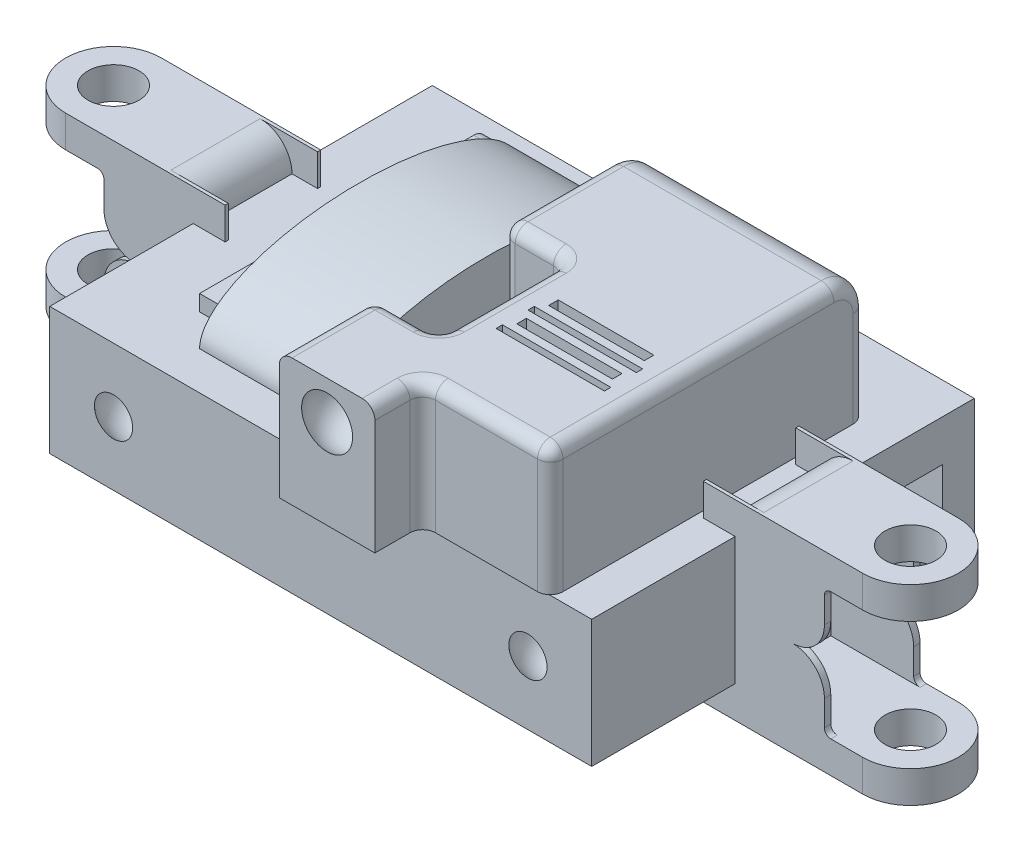
from build123d import *

# Parameters (mm, degrees)
SKETCH1_W                = 85
SKETCH1_H                = 60
BOSS_EXTRUDE1_DEPTH      = 20
BOSS_EXTRUDE4_DEPTH      = 5
SKETCH4_W                = 4
SKETCH4_H                = 14
CUT_EXTRUDE2_DEPTH       = 5
FILLET1_R                = 5
SKETCH5_W                = 14
SKETCH5_H                = 10
BOSS_EXTRUDE6_DEPTH      = 7.5
SKETCH7_W                = 12
SKETCH7_H                = 13
CUT_EXTRUDE5_DEPTH       = 10
SKETCH8_W                = 13
SKETCH8_H                = 10
CUT_EXTRUDE6_DEPTH       = 10
FILLET4_R                = 5
FILLET5_R                = 1
SKETCH9_R                = 4
CUT_EXTRUDE7_DEPTH       = 10
BOSS_EXTRUDE7_DEPTH      = 20
FILLET6_R                = 5
FILLET7_START            = 20
FILLET7_DEPTH            = 21
FILLET7_2_DEPTH          = 20
FILLET8_R                = 2
CIRPATTERN1_COUNT        = 2
FILLET1_OF_CIRPATTERN1_R = 5
FILLET4_OF_CIRPATTERN1_R = 5
FILLET5_OF_CIRPATTERN1_R = 1
CIRPATTERN5_START        = -7.5
CIRPATTERN5_DEPTH        = 1
CIRPATTERN5_START_2      = 6.5
CIRPATTERN5_2_DEPTH      = 1
CIRPATTERN5_START_3      = -5
CIRPATTERN5_3_OUTLINE_R  = 4
CIRPATTERN5_3_DEPTH      = 5
CIRPATTERN5_4_OUTLINE_W  = 1
CIRPATTERN5_4_OUTLINE_H  = 15
CIRPATTERN5_4_DEPTH      = 10
CIRPATTERN5_START_4      = -7
CIRPATTERN5_5_DEPTH      = 14
CIRPATTERN5_6_DEPTH      = 14
MIRROR1_START            = -7.5
MIRROR1_DEPTH            = 1
MIRROR1_START_2          = 6.5
MIRROR1_2_DEPTH          = 1
MIRROR1_START_3          = -5
MIRROR1_3_OUTLINE_R      = 4
MIRROR1_3_DEPTH          = 5
MIRROR1_4_OUTLINE_W      = 1
MIRROR1_4_OUTLINE_H      = 15
MIRROR1_4_DEPTH          = 10
MIRROR1_START_4          = -7
MIRROR1_5_DEPTH          = 14
MIRROR1_6_DEPTH          = 14
SKETCH16_W               = 17
SKETCH16_H               = 1
CUT_EXTRUDE9_DEPTH       = 5
BOSS_EXTRUDE8_DEPTH      = 20
BOSS_EXTRUDE9_DEPTH      = 5
SKETCH25_W               = 9
SKETCH25_H               = 7
CUT_EXTRUDE10_DEPTH      = 126.921602595
SKETCH11_W               = 15
SKETCH11_H               = 1.5
CUT_EXTRUDE8_DEPTH       = 20


with BuildPart() as part:
    # Sketch1 → Boss-Extrude1 (new body)
    with BuildSketch(Plane(origin=(0, 0, 0), x_dir=(1, 0, 0), z_dir=(0, 1, 0))):
        Rectangle(SKETCH1_W, SKETCH1_H)
    extrude(amount=BOSS_EXTRUDE1_DEPTH)

    # Sketch2 → Boss-Extrude4 (add)
    with BuildSketch(Plane(origin=(0, 20, 0), x_dir=(1, 0, 0), z_dir=(0, 1, 0))):
        with BuildLine():
            Line((-37.5, 7.5), (-62.5, 7.5))
            ThreePointArc((-62.5, 7.5), (-70, 0), (-62.5, -7.5))
            Line((-62.5, -7.5), (-37.5, -7.5))
            Line((-37.5, -7.5), (-37.5, 7.5))
        make_face()
    boss_extrude4 = extrude(amount=BOSS_EXTRUDE4_DEPTH)

    # Sketch4 → Cut-Extrude2 (cut)
    with BuildSketch(Plane(origin=(0, 25, 0), x_dir=(1, 0, 0), z_dir=(0, 1, 0))):
        with Locations((-39.5, 0)):
            Rectangle(SKETCH4_W, SKETCH4_H)
    cut_extrude2 = extrude(amount=-CUT_EXTRUDE2_DEPTH, mode=Mode.SUBTRACT)

    # Fillet1
    fillet1_edges = [part.edges().sort_by_distance(p)[0] for p in [
        (-41.5, 25, 0),
    ]]
    fillet(fillet1_edges, radius=FILLET1_R - 0.0001)  # a hair under: the kernel refuses the full size

    # Sketch5 → Boss-Extrude6 (add, symmetric)
    with BuildSketch(Plane.XY):
        with Locations((-49.5, 15)):
            Rectangle(SKETCH5_W, SKETCH5_H)
    boss_extrude6 = extrude(amount=BOSS_EXTRUDE6_DEPTH, both=True)

    # Sketch7 → Cut-Extrude5 (cut)
    with BuildSketch(Plane.XZ.offset(-10)):
        with Locations((-49.5, 0)):
            Rectangle(SKETCH7_W, SKETCH7_H)
    cut_extrude5 = extrude(amount=-CUT_EXTRUDE5_DEPTH, mode=Mode.SUBTRACT)

    # Sketch8 → Cut-Extrude6 (cut)
    with BuildSketch(Plane(origin=(-55.5, 0, 0), x_dir=(0, 0, -1), z_dir=(1, 0, 0))):
        with Locations((0, 15)):
            Rectangle(SKETCH8_W, SKETCH8_H)
    cut_extrude6 = extrude(amount=-CUT_EXTRUDE6_DEPTH, mode=Mode.SUBTRACT)

    # Fillet4
    fillet4_edges = [part.edges().sort_by_distance(p)[0] for p in [
        (-56.5, 10, -7),
        (-56.5, 10, 7),
    ]]
    fillet(fillet4_edges, radius=FILLET4_R)

    # Fillet5
    fillet5_edges = [part.edges().sort_by_distance(p)[0] for p in [
        (-56.5, 20, -7),
        (-56.5, 20, 7),
    ]]
    fillet(fillet5_edges, radius=FILLET5_R)

    # Sketch9 → Cut-Extrude7 (cut)
    with BuildSketch(Plane(origin=(0, 25, 0), x_dir=(1, 0, 0), z_dir=(0, 1, 0))):
        with Locations(Location((-62.5, 0, 0), (0, 0, 270))):
            Circle(SKETCH9_R)
    cut_extrude7 = extrude(amount=-CUT_EXTRUDE7_DEPTH, mode=Mode.SUBTRACT)

    # Sketch10 → Boss-Extrude7 (add)
    with BuildSketch(Plane(origin=(0, 20, 0), x_dir=(1, 0, 0), z_dir=(0, 1, 0))):
        Polygon((1.5, -3), (11.5, -3), (11.5, -23), (1.5, -23), (1.5, -38), (16.5, -38), (16.5, -30.5), (36.5, -30.5), (36.5, 0.746164075), (36.5, 19), (1.5, 19), align=None)
    extrude(amount=BOSS_EXTRUDE7_DEPTH)

    # Fillet6
    fillet6_edges = [part.edges().sort_by_distance(p)[0] for p in [
        (19, 40, -19),
    ]]
    fillet(fillet6_edges, radius=FILLET6_R)

    # Fillet7: read off the stored shape, not the designer's step
    # Fillet7 outline → Fillet7 (cut)
    with BuildSketch(Plane(origin=(0, 0, 0), x_dir=(1, 0, 0), z_dir=(0, 1, 0)).offset(FILLET7_START)):
        with BuildLine():
            Line((36.5, -30.5), (36.5, -28.5))
            ThreePointArc((36.5, -28.5), (35.914213562, -29.914213562), (34.5, -30.5))
            Line((34.5, -30.5), (36.5, -30.5))
        make_face()
        with BuildLine():
            Line((1.5, -23), (1.5, -25))
            ThreePointArc((1.5, -25), (2.085786438, -23.585786438), (3.5, -23))
            Line((3.5, -23), (1.5, -23))
        make_face()
        with BuildLine():
            Line((1.5, -3), (3.5, -3))
            ThreePointArc((3.5, -3), (2.085786438, -2.414213562), (1.5, -1))
            Line((1.5, -1), (1.5, -3))
        make_face()
    extrude(amount=FILLET7_DEPTH, mode=Mode.SUBTRACT)

    # Fillet7 2 outline → Fillet7 2 (add)
    with BuildSketch(Plane(origin=(0, 0, 0), x_dir=(1, 0, 0), z_dir=(0, 1, 0)).offset(FILLET7_START)):
        with BuildLine():
            ThreePointArc((16.5, -32.5), (17.085786438, -31.085786438), (18.5, -30.5))
            Line((18.5, -30.5), (16.5, -30.5))
            Line((16.5, -30.5), (16.5, -32.5))
        make_face()
        with BuildLine():
            ThreePointArc((9.5, -3), (10.914213562, -3.585786438), (11.5, -5))
            Line((11.5, -5), (11.5, -3))
            Line((11.5, -3), (9.5, -3))
        make_face()
        with BuildLine():
            ThreePointArc((11.5, -21), (10.914213562, -22.414213562), (9.5, -23))
            Line((9.5, -23), (11.5, -23))
            Line((11.5, -23), (11.5, -21))
        make_face()
    extrude(amount=FILLET7_2_DEPTH)

    # Fillet8
    fillet8_edges = [part.edges().sort_by_distance(p)[0] for p in [
        (16.5, 40, 35.25),
        (1.5, 40, -6.5),
        (1.5, 27.5, -19),
        (1.5, 38.535533906, -17.535533906),
        (36.5, 27.5, -19),
        (36.5, 38.535533906, -17.535533906),
        (36.5, 40, 7.25),
        (26.5, 40, 30.5),
        (6.5, 40, 3),
        (11.5, 40, 13),
        (6.5, 40, 23),
        (1.5, 40, 31.5),
        (2.085786438, 40, 2.414213562),
        (2.085786438, 40, 23.585786438),
        (35.914213562, 40, 29.914213562),
        (17.085786438, 40, 31.085786438),
        (10.914213562, 40, 22.414213562),
        (10.914213562, 40, 3.585786438),
    ]]
    fillet(fillet8_edges, radius=FILLET8_R)

    # CirPattern1: Boss-Extrude4, Cut-Extrude2, Boss-Extrude6, Cut-Extrude5, Cut-Extrude6, Cut-Extrude7 ×2 about axis
    cirpattern1_axis = Axis((0, 0, 0), (0, 1, 0))
    add([boss_extrude4.rotate(cirpattern1_axis, i * 360 / CIRPATTERN1_COUNT) for i in range(1, CIRPATTERN1_COUNT)])
    add([cut_extrude2.rotate(cirpattern1_axis, i * 360 / CIRPATTERN1_COUNT) for i in range(1, CIRPATTERN1_COUNT)], mode=Mode.SUBTRACT)
    add([boss_extrude6.rotate(cirpattern1_axis, i * 360 / CIRPATTERN1_COUNT) for i in range(1, CIRPATTERN1_COUNT)])
    add([cut_extrude5.rotate(cirpattern1_axis, i * 360 / CIRPATTERN1_COUNT) for i in range(1, CIRPATTERN1_COUNT)], mode=Mode.SUBTRACT)
    add([cut_extrude6.rotate(cirpattern1_axis, i * 360 / CIRPATTERN1_COUNT) for i in range(1, CIRPATTERN1_COUNT)], mode=Mode.SUBTRACT)
    add([cut_extrude7.rotate(cirpattern1_axis, i * 360 / CIRPATTERN1_COUNT) for i in range(1, CIRPATTERN1_COUNT)], mode=Mode.SUBTRACT)

    # Fillet1 of CirPattern1
    fillet1_of_cirpattern1_edges = [part.edges().sort_by_distance(p)[0] for p in [
        (41.5, 25, 0),
    ]]
    fillet(fillet1_of_cirpattern1_edges, radius=FILLET1_OF_CIRPATTERN1_R - 0.0001)  # a hair under: the kernel refuses the full size

    # Fillet4 of CirPattern1
    fillet4_of_cirpattern1_edges = [part.edges().sort_by_distance(p)[0] for p in [
        (56.5, 10, 7),
        (56.5, 10, -7),
    ]]
    fillet(fillet4_of_cirpattern1_edges, radius=FILLET4_OF_CIRPATTERN1_R)

    # Fillet5 of CirPattern1
    fillet5_of_cirpattern1_edges = [part.edges().sort_by_distance(p)[0] for p in [
        (56.5, 20, 7),
        (56.5, 20, -7),
    ]]
    fillet(fillet5_of_cirpattern1_edges, radius=FILLET5_OF_CIRPATTERN1_R)

    # CirPattern5: read off the stored shape, not the designer's step
    # CirPattern5 outline → CirPattern5 (add)
    with BuildSketch(Plane.XY.offset(CIRPATTERN5_START)):
        with BuildLine():
            ThreePointArc((57.5, 0), (56.792893219, 0.292893219), (56.5, 1))
            Line((56.5, 1), (56.5, 5))
            ThreePointArc((56.5, 5), (55.035533906, 8.535533906), (51.5, 10))
            Line((51.5, 10), (43.5, 10))
            Line((43.5, 10), (43.5, 0))
            Line((43.5, 0), (57.5, 0))
        make_face()
    extrude(amount=CIRPATTERN5_DEPTH)

    # CirPattern5 2 outline → CirPattern5 2 (add)
    with BuildSketch(Plane.XY.offset(CIRPATTERN5_START_2)):
        with BuildLine():
            ThreePointArc((57.5, 0), (56.792893219, 0.292893219), (56.5, 1))
            Line((56.5, 1), (56.5, 5))
            ThreePointArc((56.5, 5), (55.035533906, 8.535533906), (51.5, 10))
            Line((51.5, 10), (43.5, 10))
            Line((43.5, 10), (43.5, 0))
            Line((43.5, 0), (57.5, 0))
        make_face()
    extrude(amount=CIRPATTERN5_2_DEPTH)

    # CirPattern5 3 outline → CirPattern5 3 (add)
    with BuildSketch(Plane(origin=(0, 0, 0), x_dir=(1, 0, 0), z_dir=(0, 1, 0)).offset(CIRPATTERN5_START_3)):
        with BuildLine():
            Line((37.5, 7.5), (37.5, 7))
            Line((37.5, 7), (42.5, 7))
            Line((42.5, 7), (42.5, -7))
            Line((42.5, -7), (37.5, -7))
            Line((37.5, -7), (37.5, -7.5))
            Line((37.5, -7.5), (62.5, -7.5))
            ThreePointArc((62.5, -7.5), (70, 0), (62.5, 7.5))
            Line((62.5, 7.5), (37.5, 7.5))
        make_face()
        with Locations((62.5, 0)):
            Circle(CIRPATTERN5_3_OUTLINE_R, mode=Mode.SUBTRACT)
    extrude(amount=CIRPATTERN5_3_DEPTH)

    # CirPattern5 4 outline → CirPattern5 4 (add)
    with BuildSketch(Plane(origin=(0, 0, 0), x_dir=(1, 0, 0), z_dir=(0, 1, 0))):
        with Locations((43, 0)):
            Rectangle(CIRPATTERN5_4_OUTLINE_W, CIRPATTERN5_4_OUTLINE_H)
    extrude(amount=CIRPATTERN5_4_DEPTH)

    # CirPattern5 5 outline → CirPattern5 5 (cut)
    with BuildSketch(Plane.XY.offset(CIRPATTERN5_START_4)):
        with BuildLine():
            Line((42.5, -5), (46.5, -5))
            ThreePointArc((46.5, -5), (44.263932023, -4.472135955), (42.5, -3))
            Line((42.5, -3), (42.5, -5))
        make_face()
    extrude(amount=CIRPATTERN5_5_DEPTH, mode=Mode.SUBTRACT)

    # CirPattern5 6 outline → CirPattern5 6 (add)
    with BuildSketch(Plane.XY.offset(CIRPATTERN5_START_4)):
        with BuildLine():
            ThreePointArc((41.5, 0), (41.75658351, -1.58113883), (42.5, -3))
            Line((42.5, -3), (42.5, 0))
            Line((42.5, 0), (41.5, 0))
        make_face()
    extrude(amount=CIRPATTERN5_6_DEPTH)

    # Mirror1: read off the stored shape, not the designer's step
    # Mirror1 outline → Mirror1 (add)
    with BuildSketch(Plane.XY.offset(MIRROR1_START)):
        with BuildLine():
            Line((-56.5, 5), (-56.5, 1))
            ThreePointArc((-56.5, 1), (-56.792893219, 0.292893219), (-57.5, 0))
            Line((-57.5, 0), (-43.5, 0))
            Line((-43.5, 0), (-43.5, 10))
            Line((-43.5, 10), (-51.5, 10))
            ThreePointArc((-51.5, 10), (-55.035533906, 8.535533906), (-56.5, 5))
        make_face()
    extrude(amount=MIRROR1_DEPTH)

    # Mirror1 2 outline → Mirror1 2 (add)
    with BuildSketch(Plane.XY.offset(MIRROR1_START_2)):
        with BuildLine():
            Line((-56.5, 5), (-56.5, 1))
            ThreePointArc((-56.5, 1), (-56.792893219, 0.292893219), (-57.5, 0))
            Line((-57.5, 0), (-43.5, 0))
            Line((-43.5, 0), (-43.5, 10))
            Line((-43.5, 10), (-51.5, 10))
            ThreePointArc((-51.5, 10), (-55.035533906, 8.535533906), (-56.5, 5))
        make_face()
    extrude(amount=MIRROR1_2_DEPTH)

    # Mirror1 3 outline → Mirror1 3 (add)
    with BuildSketch(Plane(origin=(0, 0, 0), x_dir=(1, 0, 0), z_dir=(0, 1, 0)).offset(MIRROR1_START_3)):
        with BuildLine():
            Line((-37.5, -7.5), (-37.5, -7))
            Line((-37.5, -7), (-42.5, -7))
            Line((-42.5, -7), (-42.5, 7))
            Line((-42.5, 7), (-37.5, 7))
            Line((-37.5, 7), (-37.5, 7.5))
            Line((-37.5, 7.5), (-62.5, 7.5))
            ThreePointArc((-62.5, 7.5), (-70, 0), (-62.5, -7.5))
            Line((-62.5, -7.5), (-37.5, -7.5))
        make_face()
        with Locations((-62.5, 0)):
            Circle(MIRROR1_3_OUTLINE_R, mode=Mode.SUBTRACT)
    extrude(amount=MIRROR1_3_DEPTH)

    # Mirror1 4 outline → Mirror1 4 (add)
    with BuildSketch(Plane(origin=(0, 0, 0), x_dir=(1, 0, 0), z_dir=(0, 1, 0))):
        with Locations((-43, 0)):
            Rectangle(MIRROR1_4_OUTLINE_W, MIRROR1_4_OUTLINE_H)
    extrude(amount=MIRROR1_4_DEPTH)

    # Mirror1 5 outline → Mirror1 5 (cut)
    with BuildSketch(Plane.XY.offset(MIRROR1_START_4)):
        with BuildLine():
            ThreePointArc((-42.5, -3), (-44.263932023, -4.472135955), (-46.5, -5))
            Line((-46.5, -5), (-42.5, -5))
            Line((-42.5, -5), (-42.5, -3))
        make_face()
    extrude(amount=MIRROR1_5_DEPTH, mode=Mode.SUBTRACT)

    # Mirror1 6 outline → Mirror1 6 (add)
    with BuildSketch(Plane.XY.offset(MIRROR1_START_4)):
        with BuildLine():
            Line((-42.5, 0), (-42.5, -3))
            ThreePointArc((-42.5, -3), (-41.75658351, -1.58113883), (-41.5, 0))
            Line((-41.5, 0), (-42.5, 0))
        make_face()
    extrude(amount=MIRROR1_6_DEPTH)

    # Sketch16 → Cut-Extrude9 (cut)
    with BuildSketch(Plane(origin=(0, 40, 0), x_dir=(1, 0, 0), z_dir=(0, 1, 0))):
        with Locations((24, -12.5)):
            Rectangle(SKETCH16_W, SKETCH16_H)
        with Locations((24, -17.5)):
            Rectangle(SKETCH16_W, SKETCH16_H)
    extrude(amount=-CUT_EXTRUDE9_DEPTH, mode=Mode.SUBTRACT)

    # Sketch17 → Boss-Extrude8 (add)
    with BuildSketch(Plane(origin=(-5, 0, 0), x_dir=(0, 0, -1), z_dir=(1, 0, 0))):
        with BuildLine():
            Line((26, 20), (-24, 20))
            add(Edge.make_bspline(
                [(26, 20), (26, 30), (1, 30), (-24, 30), (-24, 20)],
                knots=[3.141592654, 3.141592654, 3.141592654, 4.71238898, 4.71238898, 6.283185307, 6.283185307, 6.283185307], degree=2, weights=[1, 0.707106781, 1, 0.707106781, 1]))
        make_face()
    extrude(amount=-BOSS_EXTRUDE8_DEPTH)

    # Sketch18 → Boss-Extrude9 (add)
    with BuildSketch(Plane.ZY.offset(25)):
        with BuildLine():
            Line((-24, 22.5), (19, 22.5))
            Line((19, 22.5), (19, 20))
            Line((19, 20), (-26, 20))
            Line((-26, 20), (-26, 20.5))
            ThreePointArc((-26, 20.5), (-25.414213562, 21.914213562), (-24, 22.5))
        make_face()
    extrude(amount=BOSS_EXTRUDE9_DEPTH)

    # Sketch19 → Cut-Revolve2 (revolve, cut)
    with BuildSketch(Plane.XY.offset(26)):
        with BuildLine():
            Line((-32.5, 15), (-32.5, 5))
            ThreePointArc((-32.5, 5), (-27.5, 10), (-32.5, 15))
        make_face()
    cut_revolve2 = revolve(axis=Axis((-32.5, 15, 26), (0, -1, 0)), mode=Mode.SUBTRACT)

    # Mirror3: Cut-Revolve2 across plane
    add(cut_revolve2.mirror(Plane(origin=(0, 0, 0), x_dir=(0, 0, 1), z_dir=(1, 0, 0))), mode=Mode.SUBTRACT)

    # Sketch24 → Cut-Revolve4 (revolve, cut)
    with BuildSketch(Plane.XY.offset(35)):
        with BuildLine():
            Line((9, 39), (9, 29))
            ThreePointArc((9, 29), (14, 34), (9, 39))
        make_face()
    revolve(axis=Axis((9, 39, 35), (0, -1, 0)), mode=Mode.SUBTRACT)

    # Sketch25 → Cut-Extrude10 (cut, through all)
    with BuildSketch(Plane.ZY.offset(42.5)):
        with Locations((-20.5, 10)):
            Rectangle(SKETCH25_W, SKETCH25_H)
    extrude(amount=-CUT_EXTRUDE10_DEPTH, mode=Mode.SUBTRACT)

    # Sketch11 → Cut-Extrude8 (cut)
    with BuildSketch(Plane(origin=(0, 40, 0), x_dir=(1, 0, 0), z_dir=(0, 1, 0))):
        with Locations((24, -15)):
            Rectangle(SKETCH11_W, SKETCH11_H)
        with Locations((24, -10)):
            Rectangle(SKETCH11_W, SKETCH11_H)
    extrude(amount=-CUT_EXTRUDE8_DEPTH, mode=Mode.SUBTRACT)


solid = part.part
